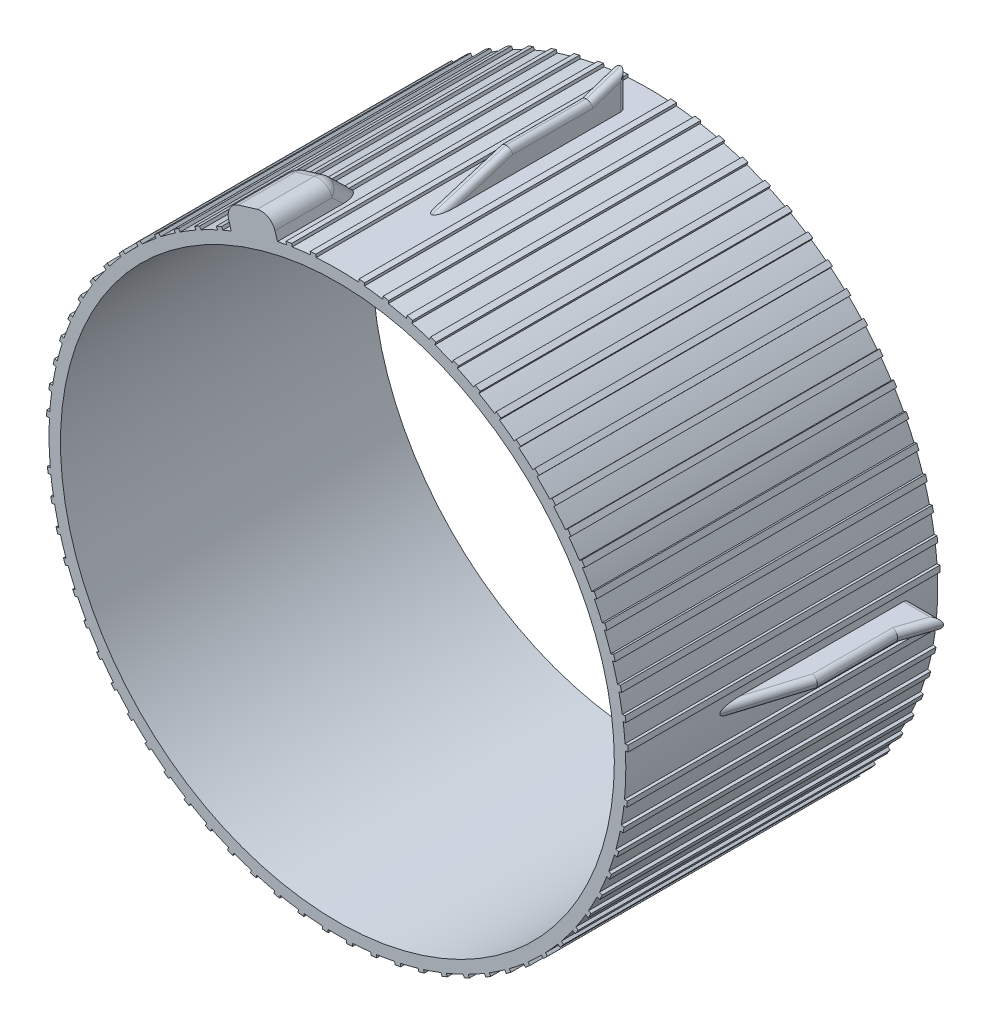
from build123d import *

# Parameters (mm, degrees)
SCHIZZO1_R                   = 5030
SCHIZZO1_R_2                 = 4830
ESTRUSIONE_ESTRUSIONE1_DEPTH = 5440
ESTRUSIONE_ESTRUSIONE4_DEPTH = 100
RACCORDO2_R                  = 100
RIPETIZIONECIRCOLARE10_COUNT = 4
ESTRUSIONE_ESTRUSIONE7_START = -5440
ESTRUSIONE_ESTRUSIONE7_DEPTH = 5440
ESTRUSIONE_ESTRUSIONE8_START = -1500
ESTRUSIONE_ESTRUSIONE8_DEPTH = 1500
SMUSSO1_SIZE                 = 399.99
RACCORDO3_R                  = 250


# Some blends are built 0.0001 mm under size
with BuildPart() as part:
    # Schizzo1 → Estrusione-Estrusione1 (new body)
    with BuildSketch(Plane.XY):
        Circle(SCHIZZO1_R)
        Circle(SCHIZZO1_R_2, mode=Mode.SUBTRACT)
    extrude(amount=ESTRUSIONE_ESTRUSIONE1_DEPTH)

    # Schizzo2 → Estrusione-Estrusione7 (add)
    with BuildSketch(Plane.XY.offset(5440).offset(ESTRUSIONE_ESTRUSIONE7_START)):
        with BuildLine():
            Line((375.258801166, 5066.367617154), (474.908087091, 5057.999832821))
            Line((474.908087091, 5057.999832821), (470.703399718, 5007.92754635))
            ThreePointArc((470.703399718, 5007.92754635), (420.899551962, 5012.359082025), (371.054113793, 5016.295330684))
            Line((371.054113793, 5016.295330684), (375.258801166, 5066.367617154))
        make_face()
        with BuildLine():
            Line((797.885431464, 5017.198305654), (896.485035171, 5000.521430982))
            Line((896.485035171, 5000.521430982), (888.105153286, 4950.976594239))
            ThreePointArc((888.105153286, 4950.976594239), (838.846795982, 4959.560066465), (789.505549579, 4967.653468911))
            Line((789.505549579, 4967.653468911), (797.885431464, 5017.198305654))
        make_face()
        with BuildLine():
            Line((1214.915468741, 4932.836952892), (1311.773784854, 4907.967964175))
            Line((1311.773784854, 4907.967964175), (1299.277487307, 4859.298098592))
            ThreePointArc((1299.277487307, 4859.298098592), (1250.910132439, 4871.973300477), (1202.419171194, 4884.167087308))
            Line((1202.419171194, 4884.167087308), (1214.915468741, 4932.836952892))
        make_face()
        with BuildLine():
            Line((1623.42374692, 4813.875293143), (1717.861383944, 4780.988628469))
            Line((1717.861383944, 4780.988628469), (1701.336323284, 4733.535118183))
            ThreePointArc((1701.336323284, 4733.535118183), (1654.199233095, 4750.213142295), (1606.89868626, 4766.421782857))
            Line((1606.89868626, 4766.421782857), (1623.42374692, 4813.875293143))
        make_face()
        with BuildLine():
            Line((2020.544873943, 4661.147756978), (2111.899419707, 4620.474092671))
            Line((2111.899419707, 4620.474092671), (2091.461507362, 4574.569789961))
            ThreePointArc((2091.461507362, 4574.569789961), (2045.885314671, 4595.133651942), (2000.106961598, 4615.243454269))
            Line((2000.106961598, 4615.243454269), (2020.544873943, 4661.147756978))
        make_face()
        with BuildLine():
            Line((2403.493330435, 4475.725618328), (2491.123998439, 4427.550250918))
            Line((2491.123998439, 4427.550250918), (2466.916591678, 4383.517141486))
            ThreePointArc((2466.916591678, 4383.517141486), (2423.220980732, 4407.822600621), (2379.285923674, 4431.692508896))
            Line((2379.285923674, 4431.692508896), (2403.493330435, 4475.725618328))
        make_face()
        with BuildLine():
            Line((2769.583008121, 4258.909480269), (2852.875132192, 4203.570325345))
            Line((2852.875132192, 4203.570325345), (2825.068028581, 4161.717269816))
            ThreePointArc((2825.068028581, 4161.717269816), (2783.559492694, 4189.593840772), (2741.77590451, 4217.056424741))
            Line((2741.77590451, 4217.056424741), (2769.583008121, 4258.909480269))
        make_face()
        with BuildLine():
            Line((3116.246050948, 4012.220152229), (3194.61539668, 3950.105374201))
            Line((3194.61539668, 3950.105374201), (3163.403643072, 3910.725941689))
            ThreePointArc((3163.403643072, 3910.725941689), (3124.3733348, 3941.978090349), (3085.03429734, 3972.840719716))
            Line((3085.03429734, 3972.840719716), (3116.246050948, 4012.220152229))
        make_face()
        with BuildLine():
            Line((3441.050866747, 3737.387982597), (3513.947729489, 3668.933272004))
            Line((3513.947729489, 3668.933272004), (3479.55025391, 3632.303680933))
            ThreePointArc((3479.55025391, 3632.303680933), (3443.271942821, 3666.71219593), (3406.653391168, 3700.758391525))
            Line((3406.653391168, 3700.758391525), (3441.050866747, 3737.387982597))
        make_face()
        with BuildLine():
            Line((3741.719183107, 3436.340721577), (3808.632243743, 3362.026239029))
            Line((3808.632243743, 3362.026239029), (3771.290319769, 3328.403419661))
            ThreePointArc((3771.290319769, 3328.403419661), (3738.018472151, 3365.726949985), (3704.377259134, 3402.717902209))
            Line((3704.377259134, 3402.717902209), (3741.719183107, 3436.340721577))
        make_face()
        with BuildLine():
            Line((4016.14202782, 3111.189999402), (4076.601939306, 3031.5370076))
            Line((4076.601939306, 3031.5370076), (4036.577493704, 3001.156799856))
            ThreePointArc((4036.577493704, 3001.156799856), (4006.545487662, 3041.133547758), (3976.117582218, 3080.809791658))
            Line((3976.117582218, 3080.809791658), (4016.14202782, 3111.189999402))
        make_face()
        with BuildLine():
            Line((4262.394521801, 2764.216514768), (4315.977201299, 2679.783722218))
            Line((4315.977201299, 2679.783722218), (4273.550976798, 2652.859221427))
            ThreePointArc((4273.550976798, 2652.859221427), (4246.969465275, 2695.208778744), (4219.9682973, 2737.292013978))
            Line((4219.9682973, 2737.292013978), (4262.394521801, 2764.216514768))
        make_face()
        with BuildLine():
            Line((4478.749380739, 2397.85403737), (4525.078984251, 2309.233679447))
            Line((4525.078984251, 2309.233679447), (4480.548570331, 2285.953741638))
            ThreePointArc((4480.548570331, 2285.953741638), (4457.604003533, 2330.379056653), (4434.218966819, 2374.574099561))
            Line((4434.218966819, 2374.574099561), (4478.749380739, 2397.85403737))
        make_face()
        with BuildLine():
            Line((4663.689030747, 2014.672336756), (4702.440589392, 1922.486021597))
            Line((4702.440589392, 1922.486021597), (4656.118334913, 1903.013938806))
            ThreePointArc((4656.118334913, 1903.013938806), (4636.97165249, 1949.203399854), (4617.366776268, 1995.200253964))
            Line((4617.366776268, 1995.200253964), (4663.689030747, 2014.672336756))
        make_face()
        with BuildLine():
            Line((4815.916253061, 1617.359157239), (4846.817952498, 1522.25350561))
            Line((4846.817952498, 1522.25350561), (4799.028774792, 1506.725860506))
            ThreePointArc((4799.028774792, 1506.725860506), (4783.814276965, 1554.355481706), (4768.127075354, 1601.831512136))
            Line((4768.127075354, 1601.831512136), (4815.916253061, 1617.359157239))
        make_face()
        with BuildLine():
            Line((4934.36328309, 1208.701365306), (4957.198370101, 1111.343475018))
            Line((4957.198370101, 1111.343475018), (4908.277475913, 1099.869182877))
            ThreePointArc((4908.277475913, 1099.869182877), (4897.101881452, 1148.604876657), (4885.442388902, 1197.227073164))
            Line((4885.442388902, 1197.227073164), (4934.36328309, 1208.701365306))
        make_face()
        with BuildLine():
            Line((5018.199300024, 791.565401745), (5032.80760288, 692.638168449))
            Line((5032.80760288, 692.638168449), (4983.098137134, 685.297713184))
            ThreePointArc((4983.098137134, 685.297713184), (4976.039834804, 734.797633669), (4968.489834277, 784.224946481))
            Line((4968.489834277, 784.224946481), (5018.199300024, 791.565401745))
        make_face()
        with BuildLine():
            Line((5066.836254439, 368.87717563), (5073.115306392, 269.074502787))
            Line((5073.115306392, 269.074502787), (5022.965945273, 265.91937242))
            ThreePointArc((5022.965945273, 265.91937242), (5020.074443994, 315.836313232), (5016.68689332, 365.722045263))
            Line((5016.68689332, 365.722045263), (5066.836254439, 368.87717563))
        make_face()
        with BuildLine():
            Line((5057.397651634, -481.278498631), (5046.944805307, -580.730688168))
            Line((5046.944805307, -580.730688168), (4996.971556845, -575.478288105))
            ThreePointArc((4996.971556845, -575.478288105), (5002.445133702, -525.778170236), (5007.424403172, -476.026098568))
            Line((5007.424403172, -476.026098568), (5057.397651634, -481.278498631))
        make_face()
        with BuildLine():
            Line((4999.388299431, -902.782715559), (4980.650167972, -1001.011440632))
            Line((4980.650167972, -1001.011440632), (4931.291692236, -991.595807819))
            ThreePointArc((4931.291692236, -991.595807819), (4940.904871165, -942.528012366), (4950.029823695, -893.367082746))
            Line((4950.029823695, -893.367082746), (4999.388299431, -902.782715559))
        make_face()
        with BuildLine():
            Line((4906.311830363, -1317.954560386), (4879.419848301, -1414.270817065))
            Line((4879.419848301, -1414.270817065), (4831.022359534, -1400.757995402))
            ThreePointArc((4831.022359534, -1400.757995402), (4844.707710992, -1352.666697695), (4857.914341595, -1304.441738723))
            Line((4857.914341595, -1304.441738723), (4906.311830363, -1317.954560386))
        make_face()
        with BuildLine():
            Line((4778.821108985, -1723.88190092), (4743.963904253, -1817.610099869))
            Line((4743.963904253, -1817.610099869), (4696.866876064, -1800.094872091))
            ThreePointArc((4696.866876064, -1800.094872091), (4714.528407144, -1753.317398029), (4731.724080797, -1706.366673142))
            Line((4731.724080797, -1706.366673142), (4778.821108985, -1723.88190092))
        make_face()
        with BuildLine():
            Line((4617.810391106, -2117.717448527), (4575.232461949, -2208.200153774))
            Line((4575.232461949, -2208.200153774), (4529.766246154, -2186.805376619))
            ThreePointArc((4529.766246154, -2186.805376619), (4551.280073904, -2141.669836572), (4572.34417531, -2096.322671372))
            Line((4572.34417531, -2096.322671372), (4617.810391106, -2117.717448527))
        make_face()
        with BuildLine():
            Line((4424.409051225, -2496.698729811), (4374.409051225, -2583.301270189))
            Line((4374.409051225, -2583.301270189), (4330.892560658, -2558.177012647))
            ThreePointArc((4330.892560658, -2558.177012647), (4356.107781036, -2515), (4380.892560658, -2471.574472268))
            Line((4380.892560658, -2471.574472268), (4424.409051225, -2496.698729811))
        make_face()
        with BuildLine():
            Line((4199.973660783, -2858.16746338), (4142.902304015, -2940.282384294))
            Line((4142.902304015, -2940.282384294), (4101.640775592, -2911.604874978))
            ThreePointArc((4101.640775592, -2911.604874978), (4130.380521943, -2870.689245453), (4158.712132361, -2829.489954065))
            Line((4158.712132361, -2829.489954065), (4199.973660783, -2858.16746338))
        make_face()
        with BuildLine():
            Line((3946.078472788, -3199.588205785), (3882.336073814, -3276.639530062))
            Line((3882.336073814, -3276.639530062), (3843.61892751, -3244.609921097))
            ThreePointArc((3843.61892751, -3244.609921097), (3875.681611162, -3206.242668436), (3907.361326485, -3167.55859682))
            Line((3907.361326485, -3167.55859682), (3946.078472788, -3199.588205785))
        make_face()
        with BuildLine():
            Line((3664.50437956, -3518.566135826), (3594.538045509, -3590.01340379))
            Line((3594.538045509, -3590.01340379), (3558.636854288, -3554.856359869))
            ThreePointArc((3558.636854288, -3554.856359869), (3593.797578553, -3519.306602782), (3628.60318834, -3483.409091906))
            Line((3628.60318834, -3483.409091906), (3664.50437956, -3518.566135826))
        make_face()
        with BuildLine():
            Line((3357.226421052, -3812.863852511), (3281.526915487, -3878.20591291))
            Line((3281.526915487, -3878.20591291), (3248.69350041, -3840.168035437))
            ThreePointArc((3248.69350041, -3840.168035437), (3286.70563807, -3807.685129928), (3324.393005976, -3774.825975038))
            Line((3324.393005976, -3774.825975038), (3357.226421052, -3812.863852511))
        make_face()
        with BuildLine():
            Line((3026.399931364, -4080.41706881), (2945.498231927, -4139.195594039))
            Line((2945.498231927, -4139.195594039), (2915.96289581, -4098.543691393))
            ThreePointArc((2915.96289581, -4098.543691393), (2956.559819031, -4069.355481706), (2996.864595248, -4039.765166164))
            Line((2996.864595248, -4039.765166164), (3026.399931364, -4080.41706881))
        make_face()
        with BuildLine():
            Line((2674.345420624, -4319.349091147), (2588.808994607, -4371.151792084))
            Line((2588.808994607, -4371.151792084), (2562.778906612, -4328.171008154))
            ThreePointArc((2562.778906612, -4328.171008154), (2605.675857147, -4302.482228607), (2648.315332628, -4276.368307216))
            Line((2648.315332628, -4276.368307216), (2674.345420624, -4319.349091147))
        make_face()
        with BuildLine():
            Line((2303.532298271, -4527.983983057), (2213.961122247, -4572.447500975))
            Line((2213.961122247, -4572.447500975), (2191.618864739, -4527.439315079))
            ThreePointArc((2191.618864739, -4527.439315079), (2236.5149513, -4505.430154004), (2281.190040763, -4482.97579716))
            Line((2281.190040763, -4482.97579716), (2303.532298271, -4527.983983057))
        make_face()
        with BuildLine():
            Line((1916.561551933, -4704.858320678), (1823.583903344, -4741.670775947))
            Line((1823.583903344, -4741.670775947), (1805.086191205, -4694.950888169))
            ThreePointArc((1805.086191205, -4694.950888169), (1851.666500004, -4676.775724018), (1898.063839794, -4658.138432901))
            Line((1898.063839794, -4658.138432901), (1916.561551933, -4704.858320678))
        make_face()
        with BuildLine():
            Line((1516.147503354, -4848.731457616), (1420.415553601, -4877.63463731))
            Line((1420.415553601, -4877.63463731), (1405.892134992, -4829.530754097))
            ThreePointArc((1405.892134992, -4829.530754097), (1453.829938631, -4815.317072586), (1501.624084746, -4800.627574402))
            Line((1501.624084746, -4800.627574402), (1516.147503354, -4848.731457616))
        make_face()
        with BuildLine():
            Line((1105.098769391, -4958.594227187), (1007.284009317, -4979.385396269))
            Line((1007.284009317, -4979.385396269), (996.836755585, -4930.234931797))
            ThreePointArc((996.836755585, -4930.234931797), (1045.795804813, -4920.082431691), (1094.651515658, -4909.443762716))
            Line((1094.651515658, -4909.443762716), (1105.098769391, -4958.594227187))
        make_face()
        with BuildLine():
            Line((686.298561572, -5033.676020999), (587.087091441, -5046.209344356))
            Line((587.087091441, -5046.209344356), (580.789282563, -4996.35705382))
            ThreePointArc((580.789282563, -4996.35705382), (630.426164828, -4990.336947612), (680.000752695, -4983.823730464))
            Line((680.000752695, -4983.823730464), (686.298561572, -5033.676020999))
        make_face()
        with BuildLine():
            Line((262.684462449, -5073.450194216), (162.772179439, -5077.637759589))
            Line((162.772179439, -5077.637759589), (160.667990021, -5027.433320988))
            ThreePointArc((160.667990021, -5027.433320988), (210.634538258, -5025.587835397), (260.580273031, -5023.245755615))
            Line((260.580273031, -5023.245755615), (262.684462449, -5073.450194216))
        make_face()
        with BuildLine():
            Line((-162.772179439, -5077.637759589), (-262.684462449, -5073.450194216))
            Line((-262.684462449, -5073.450194216), (-260.580273031, -5023.245755615))
            ThreePointArc((-260.580273031, -5023.245755615), (-210.634538258, -5025.587835397), (-160.667990021, -5027.433320988))
            Line((-160.667990021, -5027.433320988), (-162.772179439, -5077.637759589))
        make_face()
        with BuildLine():
            Line((-587.087091441, -5046.209344356), (-686.298561572, -5033.676020999))
            Line((-686.298561572, -5033.676020999), (-680.000752695, -4983.823730464))
            ThreePointArc((-680.000752695, -4983.823730464), (-630.426164828, -4990.336947612), (-580.789282564, -4996.35705382))
            Line((-580.789282564, -4996.35705382), (-587.087091441, -5046.209344356))
        make_face()
        with BuildLine():
            Line((-1007.284009318, -4979.385396269), (-1105.098769391, -4958.594227187))
            Line((-1105.098769391, -4958.594227187), (-1094.651515658, -4909.443762716))
            ThreePointArc((-1094.651515658, -4909.443762716), (-1045.795804813, -4920.082431691), (-996.836755585, -4930.234931797))
            Line((-996.836755585, -4930.234931797), (-1007.284009318, -4979.385396269))
        make_face()
        with BuildLine():
            Line((-1420.415553601, -4877.63463731), (-1516.147503355, -4848.731457616))
            Line((-1516.147503355, -4848.731457616), (-1501.624084746, -4800.627574402))
            ThreePointArc((-1501.624084746, -4800.627574402), (-1453.829938631, -4815.317072586), (-1405.892134992, -4829.530754097))
            Line((-1405.892134992, -4829.530754097), (-1420.415553601, -4877.63463731))
        make_face()
        with BuildLine():
            Line((-1823.583903344, -4741.670775947), (-1916.561551933, -4704.858320678))
            Line((-1916.561551933, -4704.858320678), (-1898.063839794, -4658.138432901))
            ThreePointArc((-1898.063839794, -4658.138432901), (-1851.666500004, -4676.775724018), (-1805.086191205, -4694.950888169))
            Line((-1805.086191205, -4694.950888169), (-1823.583903344, -4741.670775947))
        make_face()
        with BuildLine():
            Line((-2213.961122247, -4572.447500975), (-2303.532298271, -4527.983983057))
            Line((-2303.532298271, -4527.983983057), (-2281.190040763, -4482.97579716))
            ThreePointArc((-2281.190040763, -4482.97579716), (-2236.5149513, -4505.430154004), (-2191.618864739, -4527.439315079))
            Line((-2191.618864739, -4527.439315079), (-2213.961122247, -4572.447500975))
        make_face()
        with BuildLine():
            Line((-2588.808994608, -4371.151792084), (-2674.345420624, -4319.349091147))
            Line((-2674.345420624, -4319.349091147), (-2648.315332628, -4276.368307216))
            ThreePointArc((-2648.315332628, -4276.368307216), (-2605.675857147, -4302.482228607), (-2562.778906612, -4328.171008154))
            Line((-2562.778906612, -4328.171008154), (-2588.808994608, -4371.151792084))
        make_face()
        with BuildLine():
            Line((-2945.498231927, -4139.195594039), (-3026.399931365, -4080.41706881))
            Line((-3026.399931365, -4080.41706881), (-2996.864595248, -4039.765166164))
            ThreePointArc((-2996.864595248, -4039.765166164), (-2956.559819031, -4069.355481706), (-2915.96289581, -4098.543691393))
            Line((-2915.96289581, -4098.543691393), (-2945.498231927, -4139.195594039))
        make_face()
        with BuildLine():
            Line((-3281.526915487, -3878.20591291), (-3357.226421052, -3812.863852511))
            Line((-3357.226421052, -3812.863852511), (-3324.393005976, -3774.825975038))
            ThreePointArc((-3324.393005976, -3774.825975038), (-3286.70563807, -3807.685129928), (-3248.69350041, -3840.168035437))
            Line((-3248.69350041, -3840.168035437), (-3281.526915487, -3878.20591291))
        make_face()
        with BuildLine():
            Line((-3594.538045509, -3590.01340379), (-3664.50437956, -3518.566135826))
            Line((-3664.50437956, -3518.566135826), (-3628.60318834, -3483.409091906))
            ThreePointArc((-3628.60318834, -3483.409091906), (-3593.797578553, -3519.306602782), (-3558.636854288, -3554.856359869))
            Line((-3558.636854288, -3554.856359869), (-3594.538045509, -3590.01340379))
        make_face()
        with BuildLine():
            Line((-3882.336073814, -3276.639530062), (-3946.078472788, -3199.588205785))
            Line((-3946.078472788, -3199.588205785), (-3907.361326485, -3167.55859682))
            ThreePointArc((-3907.361326485, -3167.55859682), (-3875.681611162, -3206.242668436), (-3843.61892751, -3244.609921097))
            Line((-3843.61892751, -3244.609921097), (-3882.336073814, -3276.639530062))
        make_face()
        with BuildLine():
            Line((-4142.902304015, -2940.282384294), (-4199.973660783, -2858.16746338))
            Line((-4199.973660783, -2858.16746338), (-4158.712132361, -2829.489954065))
            ThreePointArc((-4158.712132361, -2829.489954065), (-4130.380521943, -2870.689245453), (-4101.640775592, -2911.604874978))
            Line((-4101.640775592, -2911.604874978), (-4142.902304015, -2940.282384294))
        make_face()
        with BuildLine():
            Line((-4374.409051225, -2583.301270189), (-4424.409051225, -2496.698729811))
            Line((-4424.409051225, -2496.698729811), (-4380.892560659, -2471.574472268))
            ThreePointArc((-4380.892560659, -2471.574472268), (-4356.107781036, -2515), (-4330.892560659, -2558.177012646))
            Line((-4330.892560659, -2558.177012646), (-4374.409051225, -2583.301270189))
        make_face()
        with BuildLine():
            Line((-4575.232461949, -2208.200153774), (-4617.810391106, -2117.717448527))
            Line((-4617.810391106, -2117.717448527), (-4572.34417531, -2096.322671372))
            ThreePointArc((-4572.34417531, -2096.322671372), (-4551.280073904, -2141.669836572), (-4529.766246154, -2186.805376619))
            Line((-4529.766246154, -2186.805376619), (-4575.232461949, -2208.200153774))
        make_face()
        with BuildLine():
            Line((-4743.963904253, -1817.610099869), (-4778.821108985, -1723.88190092))
            Line((-4778.821108985, -1723.88190092), (-4731.724080797, -1706.366673142))
            ThreePointArc((-4731.724080797, -1706.366673142), (-4714.528407144, -1753.317398029), (-4696.866876064, -1800.094872091))
            Line((-4696.866876064, -1800.094872091), (-4743.963904253, -1817.610099869))
        make_face()
        with BuildLine():
            Line((-4879.419848301, -1414.270817065), (-4906.311830363, -1317.954560386))
            Line((-4906.311830363, -1317.954560386), (-4857.914341595, -1304.441738723))
            ThreePointArc((-4857.914341595, -1304.441738723), (-4844.707710992, -1352.666697695), (-4831.022359534, -1400.757995402))
            Line((-4831.022359534, -1400.757995402), (-4879.419848301, -1414.270817065))
        make_face()
        with BuildLine():
            Line((-4980.650167972, -1001.011440632), (-4999.388299431, -902.782715559))
            Line((-4999.388299431, -902.782715559), (-4950.029823695, -893.367082746))
            ThreePointArc((-4950.029823695, -893.367082746), (-4940.904871165, -942.528012366), (-4931.291692236, -991.595807819))
            Line((-4931.291692236, -991.595807819), (-4980.650167972, -1001.011440632))
        make_face()
        with BuildLine():
            Line((-5046.944805307, -580.730688168), (-5057.397651634, -481.278498631))
            Line((-5057.397651634, -481.278498631), (-5007.424403172, -476.026098568))
            ThreePointArc((-5007.424403172, -476.026098568), (-5002.445133702, -525.778170236), (-4996.971556845, -575.478288105))
            Line((-4996.971556845, -575.478288105), (-5046.944805307, -580.730688168))
        make_face()
        with BuildLine():
            Line((-5073.115306392, 269.074502788), (-5066.836254439, 368.87717563))
            Line((-5066.836254439, 368.87717563), (-5016.68689332, 365.722045263))
            ThreePointArc((-5016.68689332, 365.722045263), (-5020.074443994, 315.836313232), (-5022.965945273, 265.91937242))
            Line((-5022.965945273, 265.91937242), (-5073.115306392, 269.074502788))
        make_face()
        with BuildLine():
            Line((-5032.80760288, 692.638168449), (-5018.199300024, 791.565401745))
            Line((-5018.199300024, 791.565401745), (-4968.489834277, 784.224946481))
            ThreePointArc((-4968.489834277, 784.224946481), (-4976.039834804, 734.797633669), (-4983.098137134, 685.297713185))
            Line((-4983.098137134, 685.297713185), (-5032.80760288, 692.638168449))
        make_face()
        with BuildLine():
            Line((-4957.198370101, 1111.343475019), (-4934.36328309, 1208.701365306))
            Line((-4934.36328309, 1208.701365306), (-4885.442388902, 1197.227073164))
            ThreePointArc((-4885.442388902, 1197.227073164), (-4897.101881452, 1148.604876657), (-4908.277475913, 1099.869182877))
            Line((-4908.277475913, 1099.869182877), (-4957.198370101, 1111.343475019))
        make_face()
        with BuildLine():
            Line((-4846.817952498, 1522.25350561), (-4815.916253061, 1617.35915724))
            Line((-4815.916253061, 1617.35915724), (-4768.127075354, 1601.831512136))
            ThreePointArc((-4768.127075354, 1601.831512136), (-4783.814276965, 1554.355481706), (-4799.028774792, 1506.725860507))
            Line((-4799.028774792, 1506.725860507), (-4846.817952498, 1522.25350561))
        make_face()
        with BuildLine():
            Line((-4702.440589392, 1922.486021597), (-4663.689030747, 2014.672336756))
            Line((-4663.689030747, 2014.672336756), (-4617.366776268, 1995.200253964))
            ThreePointArc((-4617.366776268, 1995.200253964), (-4636.97165249, 1949.203399854), (-4656.118334913, 1903.013938806))
            Line((-4656.118334913, 1903.013938806), (-4702.440589392, 1922.486021597))
        make_face()
        with BuildLine():
            Line((-4525.078984251, 2309.233679447), (-4478.749380739, 2397.854037371))
            Line((-4478.749380739, 2397.854037371), (-4434.218966819, 2374.574099561))
            ThreePointArc((-4434.218966819, 2374.574099561), (-4457.604003533, 2330.379056653), (-4480.548570331, 2285.953741638))
            Line((-4480.548570331, 2285.953741638), (-4525.078984251, 2309.233679447))
        make_face()
        with BuildLine():
            Line((-4315.977201299, 2679.783722218), (-4262.394521801, 2764.216514768))
            Line((-4262.394521801, 2764.216514768), (-4219.9682973, 2737.292013978))
            ThreePointArc((-4219.9682973, 2737.292013978), (-4246.969465275, 2695.208778744), (-4273.550976797, 2652.859221428))
            Line((-4273.550976797, 2652.859221428), (-4315.977201299, 2679.783722218))
        make_face()
        with BuildLine():
            Line((-4076.601939306, 3031.5370076), (-4016.14202782, 3111.189999402))
            Line((-4016.14202782, 3111.189999402), (-3976.117582218, 3080.809791658))
            ThreePointArc((-3976.117582218, 3080.809791658), (-4006.545487662, 3041.133547758), (-4036.577493704, 3001.156799856))
            Line((-4036.577493704, 3001.156799856), (-4076.601939306, 3031.5370076))
        make_face()
        with BuildLine():
            Line((-3808.632243743, 3362.026239029), (-3741.719183107, 3436.340721577))
            Line((-3741.719183107, 3436.340721577), (-3704.377259133, 3402.717902209))
            ThreePointArc((-3704.377259133, 3402.717902209), (-3738.018472151, 3365.726949985), (-3771.290319769, 3328.403419661))
            Line((-3771.290319769, 3328.403419661), (-3808.632243743, 3362.026239029))
        make_face()
        with BuildLine():
            Line((-3513.947729489, 3668.933272004), (-3441.050866747, 3737.387982597))
            Line((-3441.050866747, 3737.387982597), (-3406.653391168, 3700.758391525))
            ThreePointArc((-3406.653391168, 3700.758391525), (-3443.271942821, 3666.71219593), (-3479.55025391, 3632.303680933))
            Line((-3479.55025391, 3632.303680933), (-3513.947729489, 3668.933272004))
        make_face()
        with BuildLine():
            Line((-3194.61539668, 3950.105374201), (-3116.246050947, 4012.220152229))
            Line((-3116.246050947, 4012.220152229), (-3085.03429734, 3972.840719716))
            ThreePointArc((-3085.03429734, 3972.840719716), (-3124.3733348, 3941.978090349), (-3163.403643072, 3910.725941689))
            Line((-3163.403643072, 3910.725941689), (-3194.61539668, 3950.105374201))
        make_face()
        with BuildLine():
            Line((-2852.875132192, 4203.570325345), (-2769.583008121, 4258.90948027))
            Line((-2769.583008121, 4258.90948027), (-2741.77590451, 4217.056424741))
            ThreePointArc((-2741.77590451, 4217.056424741), (-2783.559492694, 4189.593840772), (-2825.068028581, 4161.717269816))
            Line((-2825.068028581, 4161.717269816), (-2852.875132192, 4203.570325345))
        make_face()
        with BuildLine():
            Line((-2491.123998439, 4427.550250918), (-2403.493330434, 4475.725618328))
            Line((-2403.493330434, 4475.725618328), (-2379.285923674, 4431.692508896))
            ThreePointArc((-2379.285923674, 4431.692508896), (-2423.220980732, 4407.822600621), (-2466.916591678, 4383.517141486))
            Line((-2466.916591678, 4383.517141486), (-2491.123998439, 4427.550250918))
        make_face()
        with BuildLine():
            Line((-2111.899419707, 4620.474092671), (-2020.544873943, 4661.147756978))
            Line((-2020.544873943, 4661.147756978), (-2000.106961597, 4615.243454269))
            ThreePointArc((-2000.106961597, 4615.243454269), (-2045.885314671, 4595.133651942), (-2091.461507362, 4574.569789961))
            Line((-2091.461507362, 4574.569789961), (-2111.899419707, 4620.474092671))
        make_face()
        with BuildLine():
            Line((-1717.861383944, 4780.988628469), (-1623.42374692, 4813.875293143))
            Line((-1623.42374692, 4813.875293143), (-1606.89868626, 4766.421782857))
            ThreePointArc((-1606.89868626, 4766.421782857), (-1654.199233095, 4750.213142295), (-1701.336323284, 4733.535118183))
            Line((-1701.336323284, 4733.535118183), (-1717.861383944, 4780.988628469))
        make_face()
        with BuildLine():
            Line((-1311.773784854, 4907.967964175), (-1214.915468741, 4932.836952892))
            Line((-1214.915468741, 4932.836952892), (-1202.419171194, 4884.167087308))
            ThreePointArc((-1202.419171194, 4884.167087308), (-1250.910132439, 4871.973300477), (-1299.277487307, 4859.298098592))
            Line((-1299.277487307, 4859.298098592), (-1311.773784854, 4907.967964175))
        make_face()
        with BuildLine():
            Line((-896.485035171, 5000.521430982), (-797.885431464, 5017.198305654))
            Line((-797.885431464, 5017.198305654), (-789.505549579, 4967.653468911))
            ThreePointArc((-789.505549579, 4967.653468911), (-838.846795982, 4959.560066465), (-888.105153286, 4950.976594239))
            Line((-888.105153286, 4950.976594239), (-896.485035171, 5000.521430982))
        make_face()
        with BuildLine():
            Line((-474.908087091, 5057.999832821), (-375.258801166, 5066.367617154))
            Line((-375.258801166, 5066.367617154), (-371.054113793, 5016.295330684))
            ThreePointArc((-371.054113793, 5016.295330684), (-420.899551961, 5012.359082025), (-470.703399718, 5007.92754635))
            Line((-470.703399718, 5007.92754635), (-474.908087091, 5057.999832821))
        make_face()
    extrude(amount=ESTRUSIONE_ESTRUSIONE7_DEPTH)

    # Schizzo4 → Estrusione-Estrusione8 (add)
    with BuildSketch(Plane.XY.offset(5440).offset(ESTRUSIONE_ESTRUSIONE8_START)):
        with BuildLine():
            Line((-1851.666500004, 4676.775724018), (-1967.279218781, 5059.703523031))
            Line((-1967.279218781, 5059.703523031), (-1161.407665758, 5303.010489698))
            Line((-1161.407665758, 5303.010489698), (-1045.795804813, 4920.082431691))
            ThreePointArc((-1045.795804813, 4920.082431691), (-1453.829938631, 4815.317072586), (-1851.666500004, 4676.775724018))
        make_face()
    extrude(amount=ESTRUSIONE_ESTRUSIONE8_DEPTH)

    # Smusso1
    # the kernel refuses this chamfer: 399.99 mm, written as the material it takes off along each edge
    with BuildSketch(Plane(origin=(-2952.023505899, 4762.39169394, 3940), x_dir=(0.2890317969433166, -0.9573194975324161, 0), z_dir=(0.957319497532416, 0.2890317969433166, 0))) as smusso1_piece_1_section:
        Polygon((SMUSSO1_SIZE, 0), (0, -SMUSSO1_SIZE), (0, 0), align=None)
    smusso1_piece_1 = extrude(amount=2899.094956713, mode=Mode.PRIVATE)
    smusso1_piece_1 = split(smusso1_piece_1, bisect_by=Plane(origin=(-2824.320557351, 4395.678777885, 3940), z_dir=(-0.32886664673856963, 0.9443763702374859, 0)), keep=Keep.TOP, mode=Mode.PRIVATE)
    add(smusso1_piece_1, mode=Mode.SUBTRACT)
    with BuildSketch(Plane(origin=(-1967.279218781, 5059.703523031, 3940), x_dir=(0.2890317969433166, -0.9573194975324161, 0), z_dir=(0.957319497532416, 0.2890317969433166, 0))) as smusso1_piece_2_section:
        Polygon((SMUSSO1_SIZE, 0), (0, -SMUSSO1_SIZE), (0, 0), align=None)
    smusso1_piece_2 = extrude(amount=1870.447478356, mode=Mode.PRIVATE)
    smusso1_piece_2 = smusso1_piece_2 - Plane(origin=(0, 0, 3940), x_dir=(1, 0, 0), z_dir=(0, 0, -1)) * Cylinder(5030, 5341, mode=Mode.PRIVATE)
    smusso1_piece_2 = split(smusso1_piece_2, bisect_by=Plane(origin=(-1831.398307755, 5107.022262649, 3940), z_dir=(-0.9443763702374854, -0.32886664673857097, 0)), keep=Keep.TOP, mode=Mode.PRIVATE)
    add(smusso1_piece_2, mode=Mode.SUBTRACT)
    with BuildSketch(Plane(origin=(-2952.023505899, 4762.39169394, 3940), x_dir=(0.2890317969433166, -0.9573194975324161, 0), z_dir=(0.957319497532416, 0.2890317969433166, 0))) as smusso1_piece_3_section:
        Polygon((SMUSSO1_SIZE, 0), (0, -SMUSSO1_SIZE), (0, 0), align=None)
    smusso1_piece_3 = extrude(amount=2899.094956713, mode=Mode.PRIVATE)
    smusso1_piece_3 = smusso1_piece_3 - Plane(origin=(0, 0, 3940), x_dir=(1, 0, 0), z_dir=(0, 0, -1)) * Cylinder(5030, 7399, mode=Mode.PRIVATE)
    smusso1_piece_3 = split(smusso1_piece_3, bisect_by=Plane(origin=(-1378.151800107, 5166.493264805, 3940), z_dir=(-0.9685831611286345, -0.24868988716484158, 0)), keep=Keep.TOP, mode=Mode.PRIVATE)
    smusso1_piece_3 = split(smusso1_piece_3, bisect_by=Plane(origin=(-1751.126695468, 5180.588209198, 3940), z_dir=(0.9443763702374854, 0.32886664673857097, 0)), keep=Keep.TOP, mode=Mode.PRIVATE)
    add(smusso1_piece_3, mode=Mode.SUBTRACT)
    with BuildSketch(Plane(origin=(-2952.023505899, 4762.39169394, 3940), x_dir=(0.2890317969433166, -0.9573194975324161, 0), z_dir=(0.957319497532416, 0.2890317969433166, 0))) as smusso1_piece_4_section:
        Polygon((SMUSSO1_SIZE, 0), (0, -SMUSSO1_SIZE), (0, 0), align=None)
    smusso1_piece_4 = extrude(amount=2899.094956713, mode=Mode.PRIVATE)
    smusso1_piece_4 = split(smusso1_piece_4, bisect_by=Plane(origin=(-2885.645490647, 4503.86639331, 3940), z_dir=(-0.2486898871648378, 0.9685831611286355, 0)), keep=Keep.TOP, mode=Mode.PRIVATE)
    add(smusso1_piece_4, mode=Mode.SUBTRACT)
    with BuildSketch(Plane(origin=(-2952.023505899, 4762.39169394, 3940), x_dir=(0.2890317969433166, -0.9573194975324161, 0), z_dir=(0.957319497532416, 0.2890317969433166, 0))) as smusso1_piece_5_section:
        Polygon((SMUSSO1_SIZE, 0), (0, -SMUSSO1_SIZE), (0, 0), align=None)
    smusso1_piece_5 = extrude(amount=2899.094956713, mode=Mode.PRIVATE)
    smusso1_piece_5 = smusso1_piece_5 - Plane(origin=(0, 0, 3940), x_dir=(1, 0, 0), z_dir=(0, 0, -1)) * Cylinder(5030, 7399, mode=Mode.PRIVATE)
    smusso1_piece_5 = split(smusso1_piece_5, bisect_by=Plane(origin=(-1281.293483994, 5191.362253522, 3940), z_dir=(0.9685831611286334, 0.24868988716484594, 0)), keep=Keep.TOP, mode=Mode.PRIVATE)
    smusso1_piece_5 = split(smusso1_piece_5, bisect_by=Plane(origin=(-1161.406454677, 5303.006478371, 3940), z_dir=(-0.9573201450168078, -0.28902965236286415, 0)), keep=Keep.TOP, mode=Mode.PRIVATE)
    add(smusso1_piece_5, mode=Mode.SUBTRACT)

    # Raccordo3
    # the kernel refuses this fillet: 250 mm, written as the material it takes off along each edge
    with BuildSketch(Plane(origin=(-1328.480127051, 4991.422504207, 4443.543390594), x_dir=(0.5527086696016945, 0.16687258576984984, 0.8164965809270783), z_dir=(0.22080521002559803, 0.9154094183103721, -0.33655706216660725))) as raccordo3_piece_1_section:
        Polygon((-450.929947191, -450.929947191), (450.929947191, -450.929947191), (450.929947191, 450.929947191), (-450.929947191, 450.929947191), align=None)
    raccordo3_piece_1 = extrude(amount=450.929947191, mode=Mode.PRIVATE)
    raccordo3_piece_1 = split(raccordo3_piece_1, bisect_by=Plane(origin=(-1328.480127051, 4991.422504207, 4443.543390594), z_dir=(0.9573194975324161, 0.2890317969433166, 1.8287651912519268e-13)), keep=Keep.TOP, mode=Mode.PRIVATE)
    raccordo3_piece_1 = split(raccordo3_piece_1, bisect_by=Plane(origin=(-1328.480127051, 4991.422504207, 4443.543390594), z_dir=(-0.20437482715002808, 0.6769275663087232, 0.7071067811856604)), keep=Keep.TOP, mode=Mode.PRIVATE)
    raccordo3_piece_1 = split(raccordo3_piece_1, bisect_by=Plane(origin=(-1328.480127051, 4991.422504207, 4443.543390594), z_dir=(0, 0, -1)), keep=Keep.TOP, mode=Mode.PRIVATE)
    raccordo3_piece_1 = split(raccordo3_piece_1, bisect_by=Plane(origin=(-1402.183235272, 5235.538976078, 4443.543390594), z_dir=(0.2890317969433166, -0.957319497532416, 0)), keep=Keep.TOP, mode=Mode.PRIVATE)
    raccordo3_piece_1 = split(raccordo3_piece_1, bisect_by=Plane(origin=(-1380.596094668, 5164.038916866, 4263.231161391), z_dir=(0.20437634359702864, -0.6769271084673072, 0.7071067811865476)), keep=Keep.TOP, mode=Mode.PRIVATE)
    raccordo3_piece_1 = split(raccordo3_piece_1, bisect_by=Plane(origin=(-1084.363490072, 5065.125065559, 4443.543390594), z_dir=(-0.9573201450168078, -0.28902965236286415, 0)), keep=Keep.TOP, mode=Mode.PRIVATE)
    raccordo3_piece_1 = raccordo3_piece_1 - Plane(origin=(-1328.480127051, 4991.422504207, 4443.543390594), x_dir=(-0.22080521002559803, -0.9154094183103721, 0.33655706216660725), z_dir=(0.5527086696016945, 0.16687258576984984, 0.8164965809270783)) * Sphere(RACCORDO3_R, mode=Mode.PRIVATE)
    with BuildSketch(Plane(origin=(-1655.691395162, 4892.631597884, 4443.543390594), x_dir=(-0.2890317969433166, 0.957319497532416, 0), z_dir=(-0.9573194975324137, -0.28903179694332404, 0))) as raccordo3_piece_2_section:
        Polygon((0, 0), (RACCORDO3_R * 1.02, 0), (RACCORDO3_R * 1.02, RACCORDO3_R * 0.422497833621), (RACCORDO3_R * 0.72124891681, RACCORDO3_R * 0.72124891681), align=None)
    raccordo3_piece_2 = extrude(amount=RACCORDO3_R * 1.02, mode=Mode.PRIVATE)
    raccordo3_piece_2 = raccordo3_piece_2 - Plane(origin=(-1655.691395162, 4892.631597884, 4443.543390594), x_dir=(0.2670305614408215, -0.8844478898442086, 0.3826834323650898), z_dir=(-0.9573194975324137, -0.28903179694332404, 0)) * Sphere(RACCORDO3_R, mode=Mode.PRIVATE)
    with BuildSketch(Plane(origin=(-1400.738076287, 5230.75237859, 4339.99), x_dir=(-3.6957572549315033e-13, 1.224093859468284e-12, 1.0), z_dir=(-0.9573194975324425, -0.28903179694322895, 0))) as raccordo3_piece_3:
        with BuildLine():
            CenterArc((RACCORDO3_R * 0.414213562373, -RACCORDO3_R), RACCORDO3_R, 90, 45)
            Line((-RACCORDO3_R * 0.292893218813, -RACCORDO3_R * 0.292893218813), (0, 0))
            Line((0, 0), (RACCORDO3_R * 0.414213562374, 0))
        make_face()
    raccordo3_piece_3_solid = extrude(amount=341.799439951, mode=Mode.PRIVATE)
    with BuildSketch(Plane(origin=(-1967.279218781, 5059.703523031, 4443.543390594), x_dir=(0.28903179694332376, -0.9573194975324139, 0), z_dir=(0, 0, 1))) as raccordo3_piece_4:
        with BuildLine():
            CenterArc((RACCORDO3_R, RACCORDO3_R), RACCORDO3_R, 180, 90)
            Line((0, RACCORDO3_R), (0, 0))
            Line((0, 0), (RACCORDO3_R, 0))
        make_face()
    raccordo3_piece_4_solid = extrude(amount=1621.456609406, mode=Mode.PRIVATE)
    with BuildSketch(Plane(origin=(-1946.115355445, 4989.605425765, 4266.766695297), x_dir=(0.20437634359732834, -0.6769271084673028, 0.707106781186465), z_dir=(0.2043763435970048, -0.676927108467228, -0.7071067811866301))) as raccordo3_piece_5_section:
        with BuildLine():
            CenterArc((RACCORDO3_R, -RACCORDO3_R), RACCORDO3_R, 90, 90)
            Line((RACCORDO3_R * 6.87189012204e-13, -RACCORDO3_R), (0, 0))
            Line((0, 0), (RACCORDO3_R, 0))
        make_face()
    raccordo3_piece_5 = extrude(amount=1087.117892221, mode=Mode.PRIVATE)
    raccordo3_piece_5 = split(raccordo3_piece_5, bisect_by=Plane(origin=(-1807.338727942, 5037.93256055, 4266.766695297), z_dir=(-0.9443763702374854, -0.32886664673857097, 0)), keep=Keep.TOP, mode=Mode.PRIVATE)
    raccordo3_piece_5 = raccordo3_piece_5 - Plane(origin=(0, 0, 4266.766695297), x_dir=(1, 0, 0), z_dir=(0, 0, -1)) * Cylinder(5030, 3175, mode=Mode.PRIVATE)
    with BuildSketch(Plane(origin=(-1946.115355445, 4989.605425765, 4266.766695297), x_dir=(0.20437634359732834, -0.6769271084673028, 0.707106781186465), z_dir=(0.2043763435970048, -0.676927108467228, -0.7071067811866301))) as raccordo3_piece_6_section:
        with BuildLine():
            CenterArc((RACCORDO3_R, -RACCORDO3_R), RACCORDO3_R, 90, 90)
            Line((RACCORDO3_R * 6.87189012204e-13, -RACCORDO3_R), (0, 0))
            Line((0, 0), (RACCORDO3_R, 0))
        make_face()
    raccordo3_piece_6 = extrude(amount=1087.117892221, mode=Mode.PRIVATE)
    raccordo3_piece_6 = split(raccordo3_piece_6, bisect_by=Plane(origin=(-1856.638011447, 4732.661493684, 4266.766695297), z_dir=(-0.32886664673856963, 0.9443763702374859, 0)), keep=Keep.TOP, mode=Mode.PRIVATE)
    with BuildSketch(Plane(origin=(-918.064225802, 4497.011605766, 3498.057561698), x_dir=(-0.9573198212745782, -0.28903072465320234, 1.1200961723989154e-06), z_dir=(-0.20437482715012173, 0.6769275663088528, 0.7071067811855093))) as raccordo3_piece_7_section:
        with BuildLine():
            CenterArc((RACCORDO3_R * 1.00000158406, RACCORDO3_R), RACCORDO3_R, 179.99990924, 90.00009076)
            Line((RACCORDO3_R * 1.58405781916e-06, RACCORDO3_R * 1.00000158406), (0, 0))
            Line((0, 0), (RACCORDO3_R * 1.00000158406, 0))
        make_face()
    raccordo3_piece_7 = extrude(amount=1087.118486242, mode=Mode.PRIVATE)
    raccordo3_piece_7 = raccordo3_piece_7 - Plane(origin=(0, 0, 3498.057561698), x_dir=(1, 0, 0), z_dir=(0, 0, -1)) * Cylinder(5030, 3175, mode=Mode.PRIVATE)
    raccordo3_piece_7 = split(raccordo3_piece_7, bisect_by=Plane(origin=(-1091.575979733, 4452.461359346, 3498.057561698), z_dir=(0.9685831611286334, 0.24868988716484594, 0)), keep=Keep.TOP, mode=Mode.PRIVATE)
    with BuildSketch(Plane(origin=(-918.064225802, 4497.011605766, 3498.057561698), x_dir=(-0.9573198212745782, -0.28903072465320234, 1.1200961723989154e-06), z_dir=(-0.20437482715012173, 0.6769275663088528, 0.7071067811855093))) as raccordo3_piece_8_section:
        with BuildLine():
            CenterArc((RACCORDO3_R * 1.00000158406, RACCORDO3_R), RACCORDO3_R, 179.99990924, 90.00009076)
            Line((RACCORDO3_R * 1.58405781916e-06, RACCORDO3_R * 1.00000158406), (0, 0))
            Line((0, 0), (RACCORDO3_R * 1.00000158406, 0))
        make_face()
    raccordo3_piece_8 = extrude(amount=1087.118486242, mode=Mode.PRIVATE)
    raccordo3_piece_8 = split(raccordo3_piece_8, bisect_by=Plane(origin=(-1041.403714811, 4977.387199312, 3498.057561698), z_dir=(-0.2486898871648378, 0.9685831611286355, 0)), keep=Keep.TOP, mode=Mode.PRIVATE)
    with BuildSketch(Plane(origin=(-1161.407665758, 5303.010489698, 4443.543390594), x_dir=(-0.9573194975324161, -0.28903179694331615, 0), z_dir=(0, 0, 1))) as raccordo3_piece_9:
        with BuildLine():
            CenterArc((RACCORDO3_R * 1.00000224019, RACCORDO3_R), RACCORDO3_R, 179.999871646, 90.000128354)
            Line((RACCORDO3_R * 2.24019727622e-06, RACCORDO3_R * 1.00000224019), (0, 0))
            Line((0, 0), (RACCORDO3_R * 1.00000224019, 0))
        make_face()
    raccordo3_piece_9_solid = extrude(amount=1621.458009528, mode=Mode.PRIVATE)
    add([raccordo3_piece_1, raccordo3_piece_2, raccordo3_piece_3_solid, raccordo3_piece_4_solid, raccordo3_piece_5, raccordo3_piece_6, raccordo3_piece_7, raccordo3_piece_8, raccordo3_piece_9_solid], mode=Mode.SUBTRACT)


with BuildPart() as body_2:
    # Schizzo3 → Estrusione-Estrusione4 (new, symmetric)
    with BuildSketch(Plane(origin=(0, 0, 0), x_dir=(0, 0, -1), z_dir=(1, 0, 0))):
        Polygon((-500, 5030), (-3800, 5030), (-2500, 5430), (-1100, 5430), (-500, 5630), align=None)
    extrude(amount=ESTRUSIONE_ESTRUSIONE4_DEPTH, both=True)

    # Raccordo2
    raccordo2_edges = [body_2.edges().sort_by_distance(p)[0] for p in [
        (100, 5330, 500),
        (100, 5530, 800),
        (100, 5430, 1800),
        (-100, 5530, 800),
        (-100, 5330, 500),
        (-100, 5230, 3150),
        (-100, 5430, 1800),
        (100, 5230, 3150),
    ]]
    fillet(raccordo2_edges, radius=RACCORDO2_R - 0.0001)  # a hair under: the kernel refuses the full size


with BuildPart() as ripetizionecircolare10_1:
    # RipetizioneCircolare10: pattern copy
    add(body_2.part.rotate(Axis((0, 0, 0), (0, 0, 1)), 1 * 360 / RIPETIZIONECIRCOLARE10_COUNT))


with BuildPart() as ripetizionecircolare10_2:
    # RipetizioneCircolare10: pattern copy
    add(body_2.part.rotate(Axis((0, 0, 0), (0, 0, 1)), 2 * 360 / RIPETIZIONECIRCOLARE10_COUNT))


with BuildPart() as ripetizionecircolare10_3:
    # RipetizioneCircolare10: pattern copy
    add(body_2.part.rotate(Axis((0, 0, 0), (0, 0, 1)), 3 * 360 / RIPETIZIONECIRCOLARE10_COUNT))


solid = Compound([part.part, body_2.part, ripetizionecircolare10_1.part, ripetizionecircolare10_2.part, ripetizionecircolare10_3.part])
